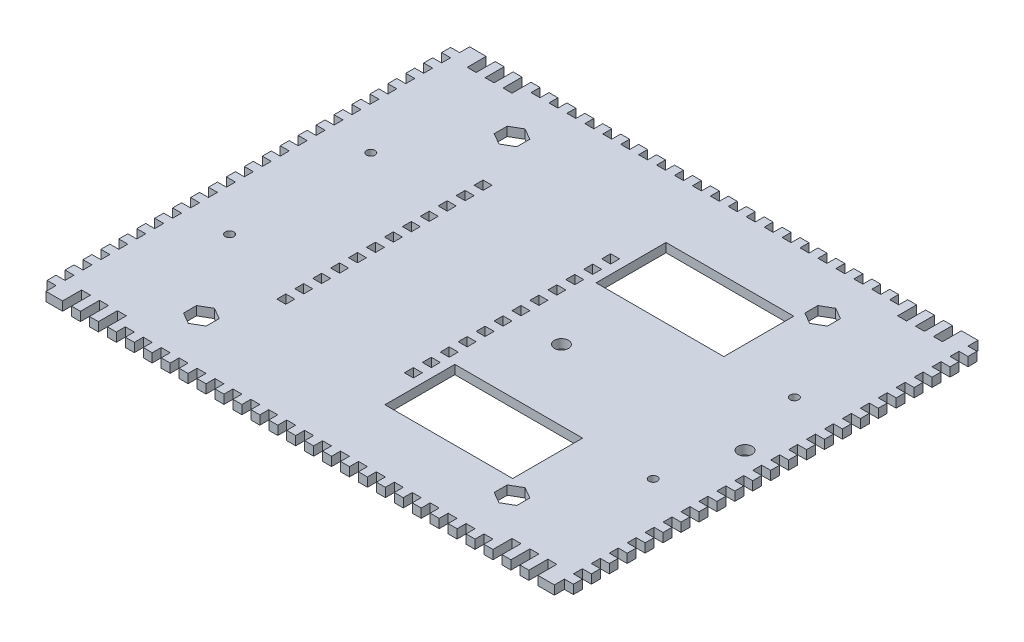
from build123d import *

# Parameters (mm, degrees)
SKETCH1_W                = 180
SKETCH1_H                = 150
BOSS_EXTRUDE1_DEPTH      = 3.175
SKETCH3_R                = 2.6
CUT_EXTRUDE1_DEPTH       = 3.175
SKETCH4_R                = 50
CUT_EXTRUDE2_DEPTH       = 3.175
SKETCH5_W                = 6.35
SKETCH5_H                = 3.175
BOSS_EXTRUDE2_DEPTH      = 3.175
LPATTERN1_COUNT          = 12
LPATTERN1_PITCH          = 6.35
LPATTERN1_COL_COUNT      = 12
LPATTERN1_COL_PITCH      = 6.35
MIRROR1_COPY_1_SKETCH_W  = 6.35
MIRROR1_COPY_1_SKETCH_H  = 3.175
MIRROR1_COPY_1_DEPTH     = 3.175
MIRROR1_COPY_2_SKETCH_W  = 6.35
MIRROR1_COPY_2_SKETCH_H  = 3.175
MIRROR1_COPY_2_DEPTH     = 3.175
MIRROR1_COPY_3_SKETCH_W  = 6.35
MIRROR1_COPY_3_SKETCH_H  = 3.175
MIRROR1_COPY_3_DEPTH     = 3.175
MIRROR1_COPY_4_SKETCH_W  = 6.35
MIRROR1_COPY_4_SKETCH_H  = 3.175
MIRROR1_COPY_4_DEPTH     = 3.175
MIRROR1_COPY_5_SKETCH_W  = 6.35
MIRROR1_COPY_5_SKETCH_H  = 3.175
MIRROR1_COPY_5_DEPTH     = 3.175
MIRROR1_COPY_6_SKETCH_W  = 6.35
MIRROR1_COPY_6_SKETCH_H  = 3.175
MIRROR1_COPY_6_DEPTH     = 3.175
MIRROR1_COPY_7_SKETCH_W  = 6.35
MIRROR1_COPY_7_SKETCH_H  = 3.175
MIRROR1_COPY_7_DEPTH     = 3.175
MIRROR1_COPY_8_SKETCH_W  = 6.35
MIRROR1_COPY_8_SKETCH_H  = 3.175
MIRROR1_COPY_8_DEPTH     = 3.175
MIRROR1_COPY_9_SKETCH_W  = 6.35
MIRROR1_COPY_9_SKETCH_H  = 3.175
MIRROR1_COPY_9_DEPTH     = 3.175
MIRROR1_COPY_10_SKETCH_W = 6.35
MIRROR1_COPY_10_SKETCH_H = 3.175
MIRROR1_COPY_10_DEPTH    = 3.175
MIRROR1_COPY_11_SKETCH_W = 6.35
MIRROR1_COPY_11_SKETCH_H = 3.175
MIRROR1_COPY_11_DEPTH    = 3.175
MIRROR1_COPY_12_SKETCH_W = 6.35
MIRROR1_COPY_12_SKETCH_H = 3.175
MIRROR1_COPY_12_DEPTH    = 3.175
MIRROR1_COPY_13_SKETCH_W = 6.35
MIRROR1_COPY_13_SKETCH_H = 3.175
MIRROR1_COPY_13_DEPTH    = 3.175
MIRROR1_COPY_14_SKETCH_W = 6.35
MIRROR1_COPY_14_SKETCH_H = 3.175
MIRROR1_COPY_14_DEPTH    = 3.175
MIRROR1_COPY_15_SKETCH_W = 6.35
MIRROR1_COPY_15_SKETCH_H = 3.175
MIRROR1_COPY_15_DEPTH    = 3.175
MIRROR1_COPY_16_SKETCH_W = 6.35
MIRROR1_COPY_16_SKETCH_H = 3.175
MIRROR1_COPY_16_DEPTH    = 3.175
MIRROR1_COPY_17_SKETCH_W = 6.35
MIRROR1_COPY_17_SKETCH_H = 3.175
MIRROR1_COPY_17_DEPTH    = 3.175
MIRROR1_COPY_18_SKETCH_W = 6.35
MIRROR1_COPY_18_SKETCH_H = 3.175
MIRROR1_COPY_18_DEPTH    = 3.175
MIRROR1_COPY_19_SKETCH_W = 6.35
MIRROR1_COPY_19_SKETCH_H = 3.175
MIRROR1_COPY_19_DEPTH    = 3.175
MIRROR1_COPY_20_SKETCH_W = 6.35
MIRROR1_COPY_20_SKETCH_H = 3.175
MIRROR1_COPY_20_DEPTH    = 3.175
MIRROR1_COPY_21_SKETCH_W = 6.35
MIRROR1_COPY_21_SKETCH_H = 3.175
MIRROR1_COPY_21_DEPTH    = 3.175
MIRROR1_COPY_22_SKETCH_W = 6.35
MIRROR1_COPY_22_SKETCH_H = 3.175
MIRROR1_COPY_22_DEPTH    = 3.175
SKETCH7_W                = 3.175
SKETCH7_H                = 3.175
CUT_EXTRUDE3_DEPTH       = 10
LPATTERN2_COUNT          = 14
LPATTERN2_PITCH          = 6.35
LPATTERN2_COL_COUNT      = 14
LPATTERN2_COL_PITCH      = 6.35
MIRROR2_COPY_1_SKETCH_W  = 3.175
MIRROR2_COPY_1_SKETCH_H  = 3.175
MIRROR2_COPY_1_DEPTH     = 10
MIRROR2_COPY_2_SKETCH_W  = 3.175
MIRROR2_COPY_2_SKETCH_H  = 3.175
MIRROR2_COPY_2_DEPTH     = 10
MIRROR2_COPY_3_SKETCH_W  = 3.175
MIRROR2_COPY_3_SKETCH_H  = 3.175
MIRROR2_COPY_3_DEPTH     = 10
MIRROR2_COPY_4_SKETCH_W  = 3.175
MIRROR2_COPY_4_SKETCH_H  = 3.175
MIRROR2_COPY_4_DEPTH     = 10
MIRROR2_COPY_5_SKETCH_W  = 3.175
MIRROR2_COPY_5_SKETCH_H  = 3.175
MIRROR2_COPY_5_DEPTH     = 10
MIRROR2_COPY_6_SKETCH_W  = 3.175
MIRROR2_COPY_6_SKETCH_H  = 3.175
MIRROR2_COPY_6_DEPTH     = 10
MIRROR2_COPY_7_SKETCH_W  = 3.175
MIRROR2_COPY_7_SKETCH_H  = 3.175
MIRROR2_COPY_7_DEPTH     = 10
MIRROR2_COPY_8_SKETCH_W  = 3.175
MIRROR2_COPY_8_SKETCH_H  = 3.175
MIRROR2_COPY_8_DEPTH     = 10
MIRROR2_COPY_9_SKETCH_W  = 3.175
MIRROR2_COPY_9_SKETCH_H  = 3.175
MIRROR2_COPY_9_DEPTH     = 10
MIRROR2_COPY_10_SKETCH_W = 3.175
MIRROR2_COPY_10_SKETCH_H = 3.175
MIRROR2_COPY_10_DEPTH    = 10
MIRROR2_COPY_11_SKETCH_W = 3.175
MIRROR2_COPY_11_SKETCH_H = 3.175
MIRROR2_COPY_11_DEPTH    = 10
MIRROR2_COPY_12_SKETCH_W = 3.175
MIRROR2_COPY_12_SKETCH_H = 3.175
MIRROR2_COPY_12_DEPTH    = 10
MIRROR2_COPY_13_SKETCH_W = 3.175
MIRROR2_COPY_13_SKETCH_H = 3.175
MIRROR2_COPY_13_DEPTH    = 10
MIRROR2_COPY_14_SKETCH_W = 3.175
MIRROR2_COPY_14_SKETCH_H = 3.175
MIRROR2_COPY_14_DEPTH    = 10
MIRROR2_COPY_15_SKETCH_W = 3.175
MIRROR2_COPY_15_SKETCH_H = 3.175
MIRROR2_COPY_15_DEPTH    = 10
MIRROR2_COPY_16_SKETCH_W = 3.175
MIRROR2_COPY_16_SKETCH_H = 3.175
MIRROR2_COPY_16_DEPTH    = 10
MIRROR2_COPY_17_SKETCH_W = 3.175
MIRROR2_COPY_17_SKETCH_H = 3.175
MIRROR2_COPY_17_DEPTH    = 10
MIRROR2_COPY_18_SKETCH_W = 3.175
MIRROR2_COPY_18_SKETCH_H = 3.175
MIRROR2_COPY_18_DEPTH    = 10
MIRROR2_COPY_19_SKETCH_W = 3.175
MIRROR2_COPY_19_SKETCH_H = 3.175
MIRROR2_COPY_19_DEPTH    = 10
MIRROR2_COPY_20_SKETCH_W = 3.175
MIRROR2_COPY_20_SKETCH_H = 3.175
MIRROR2_COPY_20_DEPTH    = 10
MIRROR2_COPY_21_SKETCH_W = 3.175
MIRROR2_COPY_21_SKETCH_H = 3.175
MIRROR2_COPY_21_DEPTH    = 10
MIRROR2_COPY_22_SKETCH_W = 3.175
MIRROR2_COPY_22_SKETCH_H = 3.175
MIRROR2_COPY_22_DEPTH    = 10
MIRROR2_COPY_23_SKETCH_W = 3.175
MIRROR2_COPY_23_SKETCH_H = 3.175
MIRROR2_COPY_23_DEPTH    = 10
MIRROR2_COPY_24_SKETCH_W = 3.175
MIRROR2_COPY_24_SKETCH_H = 3.175
MIRROR2_COPY_24_DEPTH    = 10
MIRROR2_COPY_25_SKETCH_W = 3.175
MIRROR2_COPY_25_SKETCH_H = 3.175
MIRROR2_COPY_25_DEPTH    = 10
MIRROR2_COPY_26_SKETCH_W = 3.175
MIRROR2_COPY_26_SKETCH_H = 3.175
MIRROR2_COPY_26_DEPTH    = 10
CUT_EXTRUDE5_DEPTH       = 10
BOSS_EXTRUDE3_DEPTH      = 3.175
SKETCH10_W               = 3.175
SKETCH10_H               = 3.175
CUT_EXTRUDE7_DEPTH       = 10
LPATTERN3_COUNT          = 7
LPATTERN3_PITCH          = 6.35
LPATTERN3_COUNT_DIR2     = 7
LPATTERN3_PITCH_DIR2     = 6.35
SKETCH13_R               = 1.5
CUT_EXTRUDE8_DEPTH       = 10
SKETCH15_W               = 3.175
SKETCH15_H               = 3.5625
CUT_EXTRUDE10_DEPTH      = 10
LPATTERN4_COUNT          = 3
LPATTERN4_PITCH          = 6.35
MIRROR4_COPY_1_SKETCH_W  = 3.175
MIRROR4_COPY_1_SKETCH_H  = 3.5625
MIRROR4_COPY_1_DEPTH     = 10
MIRROR4_COPY_2_SKETCH_W  = 3.175
MIRROR4_COPY_2_SKETCH_H  = 3.5625
MIRROR4_COPY_2_DEPTH     = 10
MIRROR5_COPY_1_SKETCH_W  = 3.175
MIRROR5_COPY_1_SKETCH_H  = 3.5625
MIRROR5_COPY_1_DEPTH     = 10
MIRROR5_COPY_2_SKETCH_W  = 3.175
MIRROR5_COPY_2_SKETCH_H  = 3.5625
MIRROR5_COPY_2_DEPTH     = 10
MIRROR5_COPY_3_SKETCH_W  = 3.175
MIRROR5_COPY_3_SKETCH_H  = 3.5625
MIRROR5_COPY_3_DEPTH     = 10
MIRROR5_COPY_4_SKETCH_W  = 3.175
MIRROR5_COPY_4_SKETCH_H  = 3.5625
MIRROR5_COPY_4_DEPTH     = 10
MIRROR5_COPY_5_SKETCH_W  = 3.175
MIRROR5_COPY_5_SKETCH_H  = 3.5625
MIRROR5_COPY_5_DEPTH     = 10
SKETCH17_W               = 45.2375
SKETCH17_H               = 24.772669144
CUT_EXTRUDE11_DEPTH      = 10
SKETCH18_W               = 45.2375
SKETCH18_H               = 50
BOSS_EXTRUDE4_DEPTH      = 3.175
SKETCH19_R               = 2.5
CUT_EXTRUDE12_DEPTH      = 10
SKETCH20_W               = 3.175
SKETCH20_H               = 3.175
CUT_EXTRUDE13_DEPTH      = 10
LPATTERN5_COUNT          = 7
LPATTERN5_PITCH          = 6.35
LPATTERN5_COUNT_DIR2     = 7
LPATTERN5_PITCH_DIR2     = 6.35


with BuildPart() as part:
    # Sketch1 → Boss-Extrude1 (new body)
    with BuildSketch(Plane(origin=(0, 0, 0), x_dir=(1, 0, 0), z_dir=(0, 1, 0))):
        Rectangle(SKETCH1_W, SKETCH1_H)
    extrude(amount=BOSS_EXTRUDE1_DEPTH)

    # Sketch3 → Cut-Extrude1 (cut)
    with BuildSketch(Plane(origin=(0, 3.175, 0), x_dir=(1, 0, 0), z_dir=(0, 1, 0))):
        with Locations(Location((-55, 55, 0), (0, 0, 270))):
            Circle(SKETCH3_R)
        with Locations(Location((55, 55, 0), (0, 0, 270))):
            Circle(SKETCH3_R)
        with Locations(Location((55, -55, 0), (0, 0, 270))):
            Circle(SKETCH3_R)
        with Locations(Location((-55, -55, 0), (0, 0, 270))):
            Circle(SKETCH3_R)
    extrude(amount=-CUT_EXTRUDE1_DEPTH, mode=Mode.SUBTRACT)

    # Sketch4 → Cut-Extrude2 (cut)
    with BuildSketch(Plane(origin=(0, 3.175, 0), x_dir=(1, 0, 0), z_dir=(0, 1, 0))):
        with Locations(Location((0, 0, 0), (0, 0, 270))):
            Circle(SKETCH4_R)
    extrude(amount=-CUT_EXTRUDE2_DEPTH, mode=Mode.SUBTRACT)

    # Sketch5 → Boss-Extrude2 (add)
    with BuildSketch(Plane(origin=(0, 3.175, 0), x_dir=(1, 0, 0), z_dir=(0, 1, 0))):
        with Locations((-90, 0)):
            Rectangle(SKETCH5_W, SKETCH5_H)
    boss_extrude2 = extrude(amount=-BOSS_EXTRUDE2_DEPTH)

    # LPattern1: Boss-Extrude2 ×12
    with Locations(*[(0, 0, i * LPATTERN1_PITCH) for i in range(1, LPATTERN1_COUNT)]):
        add(boss_extrude2)

    # LPattern1 col: Boss-Extrude2 ×12
    with Locations(*[(0, 0, -i * LPATTERN1_COL_PITCH) for i in range(1, LPATTERN1_COL_COUNT)]):
        add(boss_extrude2)

    # Mirror1: Boss-Extrude2 across plane
    add(boss_extrude2.mirror(Plane(origin=(0, 0, 0), x_dir=(0, 0, 1), z_dir=(1, 0, 0))))

    # Mirror1 copy 1 sketch → Mirror1 copy 1 (add)
    with BuildSketch(Plane(origin=(0, 3.175, 6.35), x_dir=(-1, 0, 0), z_dir=(0, 1, 0))):
        with Locations((-90, 0)):
            Rectangle(MIRROR1_COPY_1_SKETCH_W, MIRROR1_COPY_1_SKETCH_H)
    extrude(amount=-MIRROR1_COPY_1_DEPTH)

    # Mirror1 copy 2 sketch → Mirror1 copy 2 (add)
    with BuildSketch(Plane(origin=(0, 3.175, 12.7), x_dir=(-1, 0, 0), z_dir=(0, 1, 0))):
        with Locations((-90, 0)):
            Rectangle(MIRROR1_COPY_2_SKETCH_W, MIRROR1_COPY_2_SKETCH_H)
    extrude(amount=-MIRROR1_COPY_2_DEPTH)

    # Mirror1 copy 3 sketch → Mirror1 copy 3 (add)
    with BuildSketch(Plane(origin=(0, 3.175, 19.05), x_dir=(-1, 0, 0), z_dir=(0, 1, 0))):
        with Locations((-90, 0)):
            Rectangle(MIRROR1_COPY_3_SKETCH_W, MIRROR1_COPY_3_SKETCH_H)
    extrude(amount=-MIRROR1_COPY_3_DEPTH)

    # Mirror1 copy 4 sketch → Mirror1 copy 4 (add)
    with BuildSketch(Plane(origin=(0, 3.175, 25.4), x_dir=(-1, 0, 0), z_dir=(0, 1, 0))):
        with Locations((-90, 0)):
            Rectangle(MIRROR1_COPY_4_SKETCH_W, MIRROR1_COPY_4_SKETCH_H)
    extrude(amount=-MIRROR1_COPY_4_DEPTH)

    # Mirror1 copy 5 sketch → Mirror1 copy 5 (add)
    with BuildSketch(Plane(origin=(0, 3.175, 31.75), x_dir=(-1, 0, 0), z_dir=(0, 1, 0))):
        with Locations((-90, 0)):
            Rectangle(MIRROR1_COPY_5_SKETCH_W, MIRROR1_COPY_5_SKETCH_H)
    extrude(amount=-MIRROR1_COPY_5_DEPTH)

    # Mirror1 copy 6 sketch → Mirror1 copy 6 (add)
    with BuildSketch(Plane(origin=(0, 3.175, 38.1), x_dir=(-1, 0, 0), z_dir=(0, 1, 0))):
        with Locations((-90, 0)):
            Rectangle(MIRROR1_COPY_6_SKETCH_W, MIRROR1_COPY_6_SKETCH_H)
    extrude(amount=-MIRROR1_COPY_6_DEPTH)

    # Mirror1 copy 7 sketch → Mirror1 copy 7 (add)
    with BuildSketch(Plane(origin=(0, 3.175, 44.45), x_dir=(-1, 0, 0), z_dir=(0, 1, 0))):
        with Locations((-90, 0)):
            Rectangle(MIRROR1_COPY_7_SKETCH_W, MIRROR1_COPY_7_SKETCH_H)
    extrude(amount=-MIRROR1_COPY_7_DEPTH)

    # Mirror1 copy 8 sketch → Mirror1 copy 8 (add)
    with BuildSketch(Plane(origin=(0, 3.175, 50.8), x_dir=(-1, 0, 0), z_dir=(0, 1, 0))):
        with Locations((-90, 0)):
            Rectangle(MIRROR1_COPY_8_SKETCH_W, MIRROR1_COPY_8_SKETCH_H)
    extrude(amount=-MIRROR1_COPY_8_DEPTH)

    # Mirror1 copy 9 sketch → Mirror1 copy 9 (add)
    with BuildSketch(Plane(origin=(0, 3.175, 57.15), x_dir=(-1, 0, 0), z_dir=(0, 1, 0))):
        with Locations((-90, 0)):
            Rectangle(MIRROR1_COPY_9_SKETCH_W, MIRROR1_COPY_9_SKETCH_H)
    extrude(amount=-MIRROR1_COPY_9_DEPTH)

    # Mirror1 copy 10 sketch → Mirror1 copy 10 (add)
    with BuildSketch(Plane(origin=(0, 3.175, 63.5), x_dir=(-1, 0, 0), z_dir=(0, 1, 0))):
        with Locations((-90, 0)):
            Rectangle(MIRROR1_COPY_10_SKETCH_W, MIRROR1_COPY_10_SKETCH_H)
    extrude(amount=-MIRROR1_COPY_10_DEPTH)

    # Mirror1 copy 11 sketch → Mirror1 copy 11 (add)
    with BuildSketch(Plane(origin=(0, 3.175, 69.85), x_dir=(-1, 0, 0), z_dir=(0, 1, 0))):
        with Locations((-90, 0)):
            Rectangle(MIRROR1_COPY_11_SKETCH_W, MIRROR1_COPY_11_SKETCH_H)
    extrude(amount=-MIRROR1_COPY_11_DEPTH)

    # Mirror1 copy 12 sketch → Mirror1 copy 12 (add)
    with BuildSketch(Plane(origin=(0, 3.175, -6.35), x_dir=(-1, 0, 0), z_dir=(0, 1, 0))):
        with Locations((-90, 0)):
            Rectangle(MIRROR1_COPY_12_SKETCH_W, MIRROR1_COPY_12_SKETCH_H)
    extrude(amount=-MIRROR1_COPY_12_DEPTH)

    # Mirror1 copy 13 sketch → Mirror1 copy 13 (add)
    with BuildSketch(Plane(origin=(0, 3.175, -12.7), x_dir=(-1, 0, 0), z_dir=(0, 1, 0))):
        with Locations((-90, 0)):
            Rectangle(MIRROR1_COPY_13_SKETCH_W, MIRROR1_COPY_13_SKETCH_H)
    extrude(amount=-MIRROR1_COPY_13_DEPTH)

    # Mirror1 copy 14 sketch → Mirror1 copy 14 (add)
    with BuildSketch(Plane(origin=(0, 3.175, -19.05), x_dir=(-1, 0, 0), z_dir=(0, 1, 0))):
        with Locations((-90, 0)):
            Rectangle(MIRROR1_COPY_14_SKETCH_W, MIRROR1_COPY_14_SKETCH_H)
    extrude(amount=-MIRROR1_COPY_14_DEPTH)

    # Mirror1 copy 15 sketch → Mirror1 copy 15 (add)
    with BuildSketch(Plane(origin=(0, 3.175, -25.4), x_dir=(-1, 0, 0), z_dir=(0, 1, 0))):
        with Locations((-90, 0)):
            Rectangle(MIRROR1_COPY_15_SKETCH_W, MIRROR1_COPY_15_SKETCH_H)
    extrude(amount=-MIRROR1_COPY_15_DEPTH)

    # Mirror1 copy 16 sketch → Mirror1 copy 16 (add)
    with BuildSketch(Plane(origin=(0, 3.175, -31.75), x_dir=(-1, 0, 0), z_dir=(0, 1, 0))):
        with Locations((-90, 0)):
            Rectangle(MIRROR1_COPY_16_SKETCH_W, MIRROR1_COPY_16_SKETCH_H)
    extrude(amount=-MIRROR1_COPY_16_DEPTH)

    # Mirror1 copy 17 sketch → Mirror1 copy 17 (add)
    with BuildSketch(Plane(origin=(0, 3.175, -38.1), x_dir=(-1, 0, 0), z_dir=(0, 1, 0))):
        with Locations((-90, 0)):
            Rectangle(MIRROR1_COPY_17_SKETCH_W, MIRROR1_COPY_17_SKETCH_H)
    extrude(amount=-MIRROR1_COPY_17_DEPTH)

    # Mirror1 copy 18 sketch → Mirror1 copy 18 (add)
    with BuildSketch(Plane(origin=(0, 3.175, -44.45), x_dir=(-1, 0, 0), z_dir=(0, 1, 0))):
        with Locations((-90, 0)):
            Rectangle(MIRROR1_COPY_18_SKETCH_W, MIRROR1_COPY_18_SKETCH_H)
    extrude(amount=-MIRROR1_COPY_18_DEPTH)

    # Mirror1 copy 19 sketch → Mirror1 copy 19 (add)
    with BuildSketch(Plane(origin=(0, 3.175, -50.8), x_dir=(-1, 0, 0), z_dir=(0, 1, 0))):
        with Locations((-90, 0)):
            Rectangle(MIRROR1_COPY_19_SKETCH_W, MIRROR1_COPY_19_SKETCH_H)
    extrude(amount=-MIRROR1_COPY_19_DEPTH)

    # Mirror1 copy 20 sketch → Mirror1 copy 20 (add)
    with BuildSketch(Plane(origin=(0, 3.175, -57.15), x_dir=(-1, 0, 0), z_dir=(0, 1, 0))):
        with Locations((-90, 0)):
            Rectangle(MIRROR1_COPY_20_SKETCH_W, MIRROR1_COPY_20_SKETCH_H)
    extrude(amount=-MIRROR1_COPY_20_DEPTH)

    # Mirror1 copy 21 sketch → Mirror1 copy 21 (add)
    with BuildSketch(Plane(origin=(0, 3.175, -63.5), x_dir=(-1, 0, 0), z_dir=(0, 1, 0))):
        with Locations((-90, 0)):
            Rectangle(MIRROR1_COPY_21_SKETCH_W, MIRROR1_COPY_21_SKETCH_H)
    extrude(amount=-MIRROR1_COPY_21_DEPTH)

    # Mirror1 copy 22 sketch → Mirror1 copy 22 (add)
    with BuildSketch(Plane(origin=(0, 3.175, -69.85), x_dir=(-1, 0, 0), z_dir=(0, 1, 0))):
        with Locations((-90, 0)):
            Rectangle(MIRROR1_COPY_22_SKETCH_W, MIRROR1_COPY_22_SKETCH_H)
    extrude(amount=-MIRROR1_COPY_22_DEPTH)

    # Sketch7 → Cut-Extrude3 (cut)
    with BuildSketch(Plane(origin=(0, 3.175, 0), x_dir=(1, 0, 0), z_dir=(0, 1, 0))):
        with Locations((0, -73.4125)):
            Rectangle(SKETCH7_W, SKETCH7_H)
    cut_extrude3 = extrude(amount=-CUT_EXTRUDE3_DEPTH, mode=Mode.SUBTRACT)

    # LPattern2: Cut-Extrude3 ×14
    with Locations(*[(i * LPATTERN2_PITCH, 0, 0) for i in range(1, LPATTERN2_COUNT)]):
        add(cut_extrude3, mode=Mode.SUBTRACT)

    # LPattern2 col: Cut-Extrude3 ×14
    with Locations(*[(-i * LPATTERN2_COL_PITCH, 0, 0) for i in range(1, LPATTERN2_COL_COUNT)]):
        add(cut_extrude3, mode=Mode.SUBTRACT)

    # Mirror2: Cut-Extrude3 across plane
    add(cut_extrude3.mirror(Plane.XY), mode=Mode.SUBTRACT)

    # Mirror2 copy 1 sketch → Mirror2 copy 1 (cut)
    with BuildSketch(Plane(origin=(6.35, 3.175, 0), x_dir=(1, 0, 0), z_dir=(0, 1, 0))):
        with Locations((0, 73.4125)):
            Rectangle(MIRROR2_COPY_1_SKETCH_W, MIRROR2_COPY_1_SKETCH_H)
    extrude(amount=-MIRROR2_COPY_1_DEPTH, mode=Mode.SUBTRACT)

    # Mirror2 copy 2 sketch → Mirror2 copy 2 (cut)
    with BuildSketch(Plane(origin=(12.7, 3.175, 0), x_dir=(1, 0, 0), z_dir=(0, 1, 0))):
        with Locations((0, 73.4125)):
            Rectangle(MIRROR2_COPY_2_SKETCH_W, MIRROR2_COPY_2_SKETCH_H)
    extrude(amount=-MIRROR2_COPY_2_DEPTH, mode=Mode.SUBTRACT)

    # Mirror2 copy 3 sketch → Mirror2 copy 3 (cut)
    with BuildSketch(Plane(origin=(19.05, 3.175, 0), x_dir=(1, 0, 0), z_dir=(0, 1, 0))):
        with Locations((0, 73.4125)):
            Rectangle(MIRROR2_COPY_3_SKETCH_W, MIRROR2_COPY_3_SKETCH_H)
    extrude(amount=-MIRROR2_COPY_3_DEPTH, mode=Mode.SUBTRACT)

    # Mirror2 copy 4 sketch → Mirror2 copy 4 (cut)
    with BuildSketch(Plane(origin=(25.4, 3.175, 0), x_dir=(1, 0, 0), z_dir=(0, 1, 0))):
        with Locations((0, 73.4125)):
            Rectangle(MIRROR2_COPY_4_SKETCH_W, MIRROR2_COPY_4_SKETCH_H)
    extrude(amount=-MIRROR2_COPY_4_DEPTH, mode=Mode.SUBTRACT)

    # Mirror2 copy 5 sketch → Mirror2 copy 5 (cut)
    with BuildSketch(Plane(origin=(31.75, 3.175, 0), x_dir=(1, 0, 0), z_dir=(0, 1, 0))):
        with Locations((0, 73.4125)):
            Rectangle(MIRROR2_COPY_5_SKETCH_W, MIRROR2_COPY_5_SKETCH_H)
    extrude(amount=-MIRROR2_COPY_5_DEPTH, mode=Mode.SUBTRACT)

    # Mirror2 copy 6 sketch → Mirror2 copy 6 (cut)
    with BuildSketch(Plane(origin=(38.1, 3.175, 0), x_dir=(1, 0, 0), z_dir=(0, 1, 0))):
        with Locations((0, 73.4125)):
            Rectangle(MIRROR2_COPY_6_SKETCH_W, MIRROR2_COPY_6_SKETCH_H)
    extrude(amount=-MIRROR2_COPY_6_DEPTH, mode=Mode.SUBTRACT)

    # Mirror2 copy 7 sketch → Mirror2 copy 7 (cut)
    with BuildSketch(Plane(origin=(44.45, 3.175, 0), x_dir=(1, 0, 0), z_dir=(0, 1, 0))):
        with Locations((0, 73.4125)):
            Rectangle(MIRROR2_COPY_7_SKETCH_W, MIRROR2_COPY_7_SKETCH_H)
    extrude(amount=-MIRROR2_COPY_7_DEPTH, mode=Mode.SUBTRACT)

    # Mirror2 copy 8 sketch → Mirror2 copy 8 (cut)
    with BuildSketch(Plane(origin=(50.8, 3.175, 0), x_dir=(1, 0, 0), z_dir=(0, 1, 0))):
        with Locations((0, 73.4125)):
            Rectangle(MIRROR2_COPY_8_SKETCH_W, MIRROR2_COPY_8_SKETCH_H)
    extrude(amount=-MIRROR2_COPY_8_DEPTH, mode=Mode.SUBTRACT)

    # Mirror2 copy 9 sketch → Mirror2 copy 9 (cut)
    with BuildSketch(Plane(origin=(57.15, 3.175, 0), x_dir=(1, 0, 0), z_dir=(0, 1, 0))):
        with Locations((0, 73.4125)):
            Rectangle(MIRROR2_COPY_9_SKETCH_W, MIRROR2_COPY_9_SKETCH_H)
    extrude(amount=-MIRROR2_COPY_9_DEPTH, mode=Mode.SUBTRACT)

    # Mirror2 copy 10 sketch → Mirror2 copy 10 (cut)
    with BuildSketch(Plane(origin=(63.5, 3.175, 0), x_dir=(1, 0, 0), z_dir=(0, 1, 0))):
        with Locations((0, 73.4125)):
            Rectangle(MIRROR2_COPY_10_SKETCH_W, MIRROR2_COPY_10_SKETCH_H)
    extrude(amount=-MIRROR2_COPY_10_DEPTH, mode=Mode.SUBTRACT)

    # Mirror2 copy 11 sketch → Mirror2 copy 11 (cut)
    with BuildSketch(Plane(origin=(69.85, 3.175, 0), x_dir=(1, 0, 0), z_dir=(0, 1, 0))):
        with Locations((0, 73.4125)):
            Rectangle(MIRROR2_COPY_11_SKETCH_W, MIRROR2_COPY_11_SKETCH_H)
    extrude(amount=-MIRROR2_COPY_11_DEPTH, mode=Mode.SUBTRACT)

    # Mirror2 copy 12 sketch → Mirror2 copy 12 (cut)
    with BuildSketch(Plane(origin=(76.2, 3.175, 0), x_dir=(1, 0, 0), z_dir=(0, 1, 0))):
        with Locations((0, 73.4125)):
            Rectangle(MIRROR2_COPY_12_SKETCH_W, MIRROR2_COPY_12_SKETCH_H)
    extrude(amount=-MIRROR2_COPY_12_DEPTH, mode=Mode.SUBTRACT)

    # Mirror2 copy 13 sketch → Mirror2 copy 13 (cut)
    with BuildSketch(Plane(origin=(82.55, 3.175, 0), x_dir=(1, 0, 0), z_dir=(0, 1, 0))):
        with Locations((0, 73.4125)):
            Rectangle(MIRROR2_COPY_13_SKETCH_W, MIRROR2_COPY_13_SKETCH_H)
    extrude(amount=-MIRROR2_COPY_13_DEPTH, mode=Mode.SUBTRACT)

    # Mirror2 copy 14 sketch → Mirror2 copy 14 (cut)
    with BuildSketch(Plane(origin=(-6.35, 3.175, 0), x_dir=(1, 0, 0), z_dir=(0, 1, 0))):
        with Locations((0, 73.4125)):
            Rectangle(MIRROR2_COPY_14_SKETCH_W, MIRROR2_COPY_14_SKETCH_H)
    extrude(amount=-MIRROR2_COPY_14_DEPTH, mode=Mode.SUBTRACT)

    # Mirror2 copy 15 sketch → Mirror2 copy 15 (cut)
    with BuildSketch(Plane(origin=(-12.7, 3.175, 0), x_dir=(1, 0, 0), z_dir=(0, 1, 0))):
        with Locations((0, 73.4125)):
            Rectangle(MIRROR2_COPY_15_SKETCH_W, MIRROR2_COPY_15_SKETCH_H)
    extrude(amount=-MIRROR2_COPY_15_DEPTH, mode=Mode.SUBTRACT)

    # Mirror2 copy 16 sketch → Mirror2 copy 16 (cut)
    with BuildSketch(Plane(origin=(-19.05, 3.175, 0), x_dir=(1, 0, 0), z_dir=(0, 1, 0))):
        with Locations((0, 73.4125)):
            Rectangle(MIRROR2_COPY_16_SKETCH_W, MIRROR2_COPY_16_SKETCH_H)
    extrude(amount=-MIRROR2_COPY_16_DEPTH, mode=Mode.SUBTRACT)

    # Mirror2 copy 17 sketch → Mirror2 copy 17 (cut)
    with BuildSketch(Plane(origin=(-25.4, 3.175, 0), x_dir=(1, 0, 0), z_dir=(0, 1, 0))):
        with Locations((0, 73.4125)):
            Rectangle(MIRROR2_COPY_17_SKETCH_W, MIRROR2_COPY_17_SKETCH_H)
    extrude(amount=-MIRROR2_COPY_17_DEPTH, mode=Mode.SUBTRACT)

    # Mirror2 copy 18 sketch → Mirror2 copy 18 (cut)
    with BuildSketch(Plane(origin=(-31.75, 3.175, 0), x_dir=(1, 0, 0), z_dir=(0, 1, 0))):
        with Locations((0, 73.4125)):
            Rectangle(MIRROR2_COPY_18_SKETCH_W, MIRROR2_COPY_18_SKETCH_H)
    extrude(amount=-MIRROR2_COPY_18_DEPTH, mode=Mode.SUBTRACT)

    # Mirror2 copy 19 sketch → Mirror2 copy 19 (cut)
    with BuildSketch(Plane(origin=(-38.1, 3.175, 0), x_dir=(1, 0, 0), z_dir=(0, 1, 0))):
        with Locations((0, 73.4125)):
            Rectangle(MIRROR2_COPY_19_SKETCH_W, MIRROR2_COPY_19_SKETCH_H)
    extrude(amount=-MIRROR2_COPY_19_DEPTH, mode=Mode.SUBTRACT)

    # Mirror2 copy 20 sketch → Mirror2 copy 20 (cut)
    with BuildSketch(Plane(origin=(-44.45, 3.175, 0), x_dir=(1, 0, 0), z_dir=(0, 1, 0))):
        with Locations((0, 73.4125)):
            Rectangle(MIRROR2_COPY_20_SKETCH_W, MIRROR2_COPY_20_SKETCH_H)
    extrude(amount=-MIRROR2_COPY_20_DEPTH, mode=Mode.SUBTRACT)

    # Mirror2 copy 21 sketch → Mirror2 copy 21 (cut)
    with BuildSketch(Plane(origin=(-50.8, 3.175, 0), x_dir=(1, 0, 0), z_dir=(0, 1, 0))):
        with Locations((0, 73.4125)):
            Rectangle(MIRROR2_COPY_21_SKETCH_W, MIRROR2_COPY_21_SKETCH_H)
    extrude(amount=-MIRROR2_COPY_21_DEPTH, mode=Mode.SUBTRACT)

    # Mirror2 copy 22 sketch → Mirror2 copy 22 (cut)
    with BuildSketch(Plane(origin=(-57.15, 3.175, 0), x_dir=(1, 0, 0), z_dir=(0, 1, 0))):
        with Locations((0, 73.4125)):
            Rectangle(MIRROR2_COPY_22_SKETCH_W, MIRROR2_COPY_22_SKETCH_H)
    extrude(amount=-MIRROR2_COPY_22_DEPTH, mode=Mode.SUBTRACT)

    # Mirror2 copy 23 sketch → Mirror2 copy 23 (cut)
    with BuildSketch(Plane(origin=(-63.5, 3.175, 0), x_dir=(1, 0, 0), z_dir=(0, 1, 0))):
        with Locations((0, 73.4125)):
            Rectangle(MIRROR2_COPY_23_SKETCH_W, MIRROR2_COPY_23_SKETCH_H)
    extrude(amount=-MIRROR2_COPY_23_DEPTH, mode=Mode.SUBTRACT)

    # Mirror2 copy 24 sketch → Mirror2 copy 24 (cut)
    with BuildSketch(Plane(origin=(-69.85, 3.175, 0), x_dir=(1, 0, 0), z_dir=(0, 1, 0))):
        with Locations((0, 73.4125)):
            Rectangle(MIRROR2_COPY_24_SKETCH_W, MIRROR2_COPY_24_SKETCH_H)
    extrude(amount=-MIRROR2_COPY_24_DEPTH, mode=Mode.SUBTRACT)

    # Mirror2 copy 25 sketch → Mirror2 copy 25 (cut)
    with BuildSketch(Plane(origin=(-76.2, 3.175, 0), x_dir=(1, 0, 0), z_dir=(0, 1, 0))):
        with Locations((0, 73.4125)):
            Rectangle(MIRROR2_COPY_25_SKETCH_W, MIRROR2_COPY_25_SKETCH_H)
    extrude(amount=-MIRROR2_COPY_25_DEPTH, mode=Mode.SUBTRACT)

    # Mirror2 copy 26 sketch → Mirror2 copy 26 (cut)
    with BuildSketch(Plane(origin=(-82.55, 3.175, 0), x_dir=(1, 0, 0), z_dir=(0, 1, 0))):
        with Locations((0, 73.4125)):
            Rectangle(MIRROR2_COPY_26_SKETCH_W, MIRROR2_COPY_26_SKETCH_H)
    extrude(amount=-MIRROR2_COPY_26_DEPTH, mode=Mode.SUBTRACT)

    # Sketch9 → Cut-Extrude5 (cut)
    with BuildSketch(Plane(origin=(0, 3.175, 0), x_dir=(1, 0, 0), z_dir=(0, 1, 0))):
        Polygon((-55, 50.381197846), (-51, 52.690598923), (-51, 57.309401077), (-55, 59.618802154), (-59, 57.309401077), (-59, 52.690598923), align=None)
        Polygon((-55, -59.618802154), (-51, -57.309401077), (-51, -52.690598923), (-55, -50.381197846), (-59, -52.690598923), (-59, -57.309401077), align=None)
        Polygon((55, 50.381197846), (59, 52.690598923), (59, 57.309401077), (55, 59.618802154), (51, 57.309401077), (51, 52.690598923), align=None)
        Polygon((55, -59.618802154), (59, -57.309401077), (59, -52.690598923), (55, -50.381197846), (51, -52.690598923), (51, -57.309401077), align=None)
    extrude(amount=-CUT_EXTRUDE5_DEPTH, mode=Mode.SUBTRACT)

    # Sketch11 → Boss-Extrude3 (add)
    with BuildSketch(Plane(origin=(0, 3.175, 0), x_dir=(1, 0, 0), z_dir=(0, 1, 0))):
        Polygon((-1.5875, 60), (-50.4125, 60), (-50.4125, -60), (-1.5875, -60), (1.5875, -60), (4.7625, -60), (4.7625, 60), (1.5875, 60), align=None)
    extrude(amount=-BOSS_EXTRUDE3_DEPTH)

    # Sketch10 → Cut-Extrude7 (cut)
    with BuildSketch(Plane(origin=(0, 3.175, 0), x_dir=(1, 0, 0), z_dir=(0, 1, 0))):
        with Locations((0, 3.175)):
            Rectangle(SKETCH10_W, SKETCH10_H)
    cut_extrude7 = extrude(amount=-CUT_EXTRUDE7_DEPTH, mode=Mode.SUBTRACT)

    # LPattern3: Cut-Extrude7 7 × 7, 1 skipped
    with Locations(*[Vector(0, 0, 1) * (i * LPATTERN3_PITCH) + Vector(0, 0, -1) * (j * LPATTERN3_PITCH_DIR2) for i in range(LPATTERN3_COUNT) for j in range(LPATTERN3_COUNT_DIR2) if (i, j) not in ((0, 0), (0, 6))]):
        add(cut_extrude7, mode=Mode.SUBTRACT)

    # Sketch13 → Cut-Extrude8 (cut)
    with BuildSketch(Plane(origin=(0, 3.175, 0), x_dir=(1, 0, 0), z_dir=(0, 1, 0))):
        with Locations(Location((75, -25, 0), (0, 0, 270))):
            Circle(SKETCH13_R)
        with Locations(Location((75, 25, 0), (0, 0, 270))):
            Circle(SKETCH13_R)
        with Locations(Location((-75, 25, 0), (0, 0, 270))):
            Circle(SKETCH13_R)
        with Locations(Location((-75, -25, 0), (0, 0, 270))):
            Circle(SKETCH13_R)
    extrude(amount=-CUT_EXTRUDE8_DEPTH, mode=Mode.SUBTRACT)

    # Sketch15 → Cut-Extrude10 (cut)
    with BuildSketch(Plane(origin=(0, 3.175, 0), x_dir=(1, 0, 0), z_dir=(0, 1, 0))):
        with Locations((-82.55, 70.04375)):
            Rectangle(SKETCH15_W, SKETCH15_H)
    cut_extrude10 = extrude(amount=-CUT_EXTRUDE10_DEPTH, mode=Mode.SUBTRACT)

    # LPattern4: Cut-Extrude10 ×3
    with Locations(*[(i * LPATTERN4_PITCH, 0, 0) for i in range(1, LPATTERN4_COUNT)]):
        add(cut_extrude10, mode=Mode.SUBTRACT)

    # Mirror4: Cut-Extrude10 across plane
    add(cut_extrude10.mirror(Plane(origin=(0, 0, 0), x_dir=(0, 0, 1), z_dir=(1, 0, 0))), mode=Mode.SUBTRACT)

    # Mirror4 copy 1 sketch → Mirror4 copy 1 (cut)
    with BuildSketch(Plane(origin=(-6.35, 3.175, 0), x_dir=(-1, 0, 0), z_dir=(0, 1, 0))):
        with Locations((-82.55, -70.04375)):
            Rectangle(MIRROR4_COPY_1_SKETCH_W, MIRROR4_COPY_1_SKETCH_H)
    extrude(amount=-MIRROR4_COPY_1_DEPTH, mode=Mode.SUBTRACT)

    # Mirror4 copy 2 sketch → Mirror4 copy 2 (cut)
    with BuildSketch(Plane(origin=(-12.7, 3.175, 0), x_dir=(-1, 0, 0), z_dir=(0, 1, 0))):
        with Locations((-82.55, -70.04375)):
            Rectangle(MIRROR4_COPY_2_SKETCH_W, MIRROR4_COPY_2_SKETCH_H)
    extrude(amount=-MIRROR4_COPY_2_DEPTH, mode=Mode.SUBTRACT)

    # Mirror5: Cut-Extrude10 across plane
    add(cut_extrude10.mirror(Plane.XY), mode=Mode.SUBTRACT)

    # Mirror5 copy 1 sketch → Mirror5 copy 1 (cut)
    with BuildSketch(Plane(origin=(6.35, 3.175, 0), x_dir=(1, 0, 0), z_dir=(0, 1, 0))):
        with Locations((-82.55, -70.04375)):
            Rectangle(MIRROR5_COPY_1_SKETCH_W, MIRROR5_COPY_1_SKETCH_H)
    extrude(amount=-MIRROR5_COPY_1_DEPTH, mode=Mode.SUBTRACT)

    # Mirror5 copy 2 sketch → Mirror5 copy 2 (cut)
    with BuildSketch(Plane(origin=(12.7, 3.175, 0), x_dir=(1, 0, 0), z_dir=(0, 1, 0))):
        with Locations((-82.55, -70.04375)):
            Rectangle(MIRROR5_COPY_2_SKETCH_W, MIRROR5_COPY_2_SKETCH_H)
    extrude(amount=-MIRROR5_COPY_2_DEPTH, mode=Mode.SUBTRACT)

    # Mirror5 copy 3 sketch → Mirror5 copy 3 (cut)
    with BuildSketch(Plane(origin=(0, 3.175, 0), x_dir=(-1, 0, 0), z_dir=(0, 1, 0))):
        with Locations((-82.55, 70.04375)):
            Rectangle(MIRROR5_COPY_3_SKETCH_W, MIRROR5_COPY_3_SKETCH_H)
    extrude(amount=-MIRROR5_COPY_3_DEPTH, mode=Mode.SUBTRACT)

    # Mirror5 copy 4 sketch → Mirror5 copy 4 (cut)
    with BuildSketch(Plane(origin=(-6.35, 3.175, 0), x_dir=(-1, 0, 0), z_dir=(0, 1, 0))):
        with Locations((-82.55, 70.04375)):
            Rectangle(MIRROR5_COPY_4_SKETCH_W, MIRROR5_COPY_4_SKETCH_H)
    extrude(amount=-MIRROR5_COPY_4_DEPTH, mode=Mode.SUBTRACT)

    # Mirror5 copy 5 sketch → Mirror5 copy 5 (cut)
    with BuildSketch(Plane(origin=(-12.7, 3.175, 0), x_dir=(-1, 0, 0), z_dir=(0, 1, 0))):
        with Locations((-82.55, 70.04375)):
            Rectangle(MIRROR5_COPY_5_SKETCH_W, MIRROR5_COPY_5_SKETCH_H)
    extrude(amount=-MIRROR5_COPY_5_DEPTH, mode=Mode.SUBTRACT)

    # Sketch17 → Cut-Extrude11 (cut)
    with BuildSketch(Plane(origin=(0, 3.175, 0), x_dir=(1, 0, 0), z_dir=(0, 1, 0))):
        with Locations((27.38125, 37.386334572)):
            Rectangle(SKETCH17_W, SKETCH17_H)
    cut_extrude11 = extrude(amount=-CUT_EXTRUDE11_DEPTH, mode=Mode.SUBTRACT)

    # Mirror6: Cut-Extrude11 across plane
    add(cut_extrude11.mirror(Plane.XY), mode=Mode.SUBTRACT)

    # Sketch18 → Boss-Extrude4 (add)
    with BuildSketch(Plane(origin=(0, 3.175, 0), x_dir=(1, 0, 0), z_dir=(0, 1, 0))):
        with Locations((27.38125, 0)):
            Rectangle(SKETCH18_W, SKETCH18_H)
    extrude(amount=-BOSS_EXTRUDE4_DEPTH)

    # Sketch19 → Cut-Extrude12 (cut)
    with BuildSketch(Plane(origin=(0, 3.175, 0), x_dir=(1, 0, 0), z_dir=(0, 1, 0))):
        with Locations(Location((17.5, 0, 0), (0, 0, 270))):
            Circle(SKETCH19_R)
        with Locations(Location((82.5, 0, 0), (0, 0, 270))):
            Circle(SKETCH19_R)
    extrude(amount=-CUT_EXTRUDE12_DEPTH, mode=Mode.SUBTRACT)

    # Sketch20 → Cut-Extrude13 (cut)
    with BuildSketch(Plane(origin=(0, 3.175, 0), x_dir=(1, 0, 0), z_dir=(0, 1, 0))):
        with Locations((-45.175, 3.175)):
            Rectangle(SKETCH20_W, SKETCH20_H)
    cut_extrude13 = extrude(amount=-CUT_EXTRUDE13_DEPTH, mode=Mode.SUBTRACT)

    # LPattern5: Cut-Extrude13 7 × 7, 1 skipped
    with Locations(*[Vector(0, 0, 1) * (i * LPATTERN5_PITCH) + Vector(0, 0, -1) * (j * LPATTERN5_PITCH_DIR2) for i in range(LPATTERN5_COUNT) for j in range(LPATTERN5_COUNT_DIR2) if (i, j) not in ((0, 0), (0, 6))]):
        add(cut_extrude13, mode=Mode.SUBTRACT)


solid = part.part
